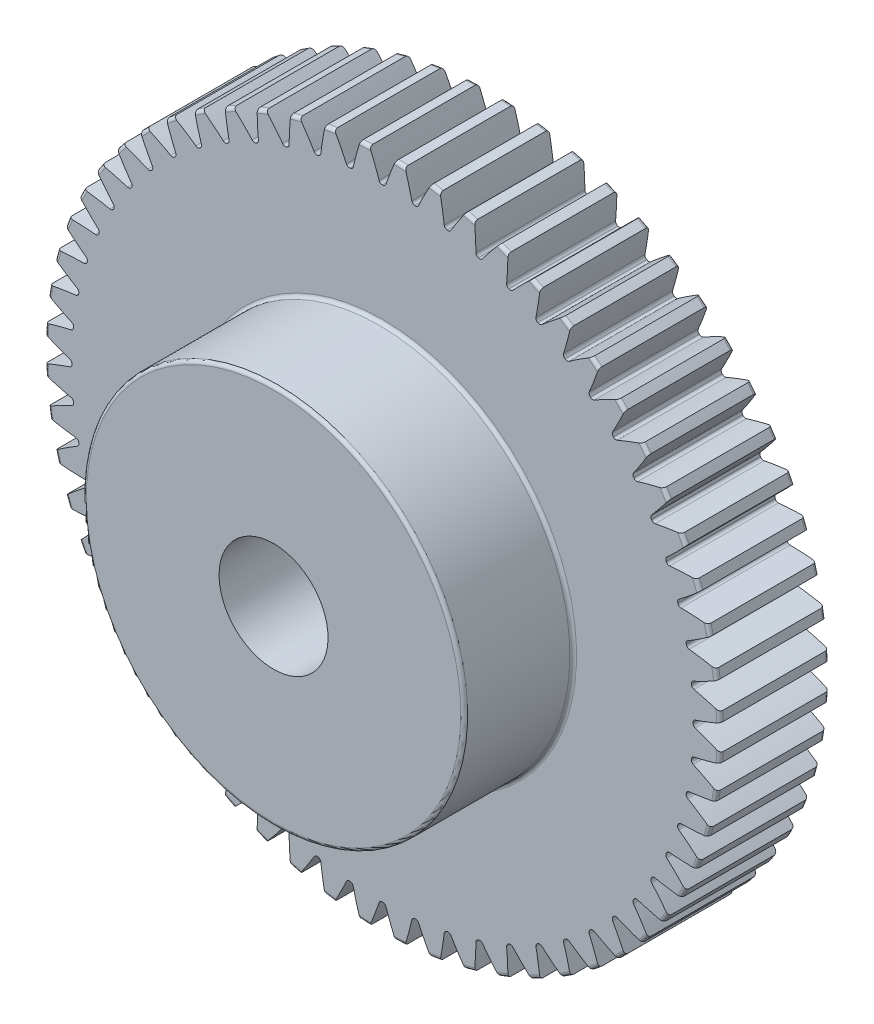
from build123d import *

# Parameters (mm, degrees)
FILLET2_R          = 0.31
CUT_EXTRUDE2_DEPTH = 45.966654381
CIRPATTERN1_COUNT  = 60


with BuildPart() as part:
    # Sketch4 → Revolve1 (revolve)
    with BuildSketch(Plane(origin=(0, 0, 0), x_dir=(0, 0, -1), z_dir=(1, 0, 0))):
        Polygon((-20, 5), (-20, 17.5), (-10, 17.5), (-10, 31), (0, 31), (0, 5), align=None)
    revolve(axis=Axis((0, 0, 10), (0, 0, 1)))

    # Fillet2
    fillet2_edges = [part.edges().sort_by_distance(p)[0] for p in [
        (0, -17.5, 20),
        (0, -17.5, 10),
        (0, -31, 10),
        (0, -31, 0),
    ]]
    fillet(fillet2_edges, radius=FILLET2_R)

    # Sketch7 → Cut-Extrude2 (cut, through all)
    with BuildSketch(Plane.XY.offset(10)):
        with BuildLine():
            ThreePointArc((-0.027924152, 28.49998632), (0, 28.5), (0.027924152, 28.49998632))
            ThreePointArc((0.027924152, 28.49998632), (0.20257511, 28.555850808), (0.31209617, 28.702918602))
            ThreePointArc((0.31209617, 28.702918602), (0.730254377, 29.848919172), (1.194657711, 30.976971978))
            ThreePointArc((1.194657711, 30.976971978), (0, 31), (-1.194657711, 30.976971978))
            ThreePointArc((-1.194657711, 30.976971978), (-0.730254377, 29.848919172), (-0.31209617, 28.702918602))
            ThreePointArc((-0.31209617, 28.702918602), (-0.20257511, 28.555850808), (-0.027924152, 28.49998632))
        make_face()
    cut_extrude2 = extrude(amount=-CUT_EXTRUDE2_DEPTH, mode=Mode.SUBTRACT)

    # CirPattern1: Cut-Extrude2 ×60 about axis
    cirpattern1_axis = Axis((0, 0, 20), (0, 0, -1))
    for i in range(1, CIRPATTERN1_COUNT):
        add(cut_extrude2.rotate(cirpattern1_axis, i * 360 / CIRPATTERN1_COUNT), mode=Mode.SUBTRACT)


solid = part.part
